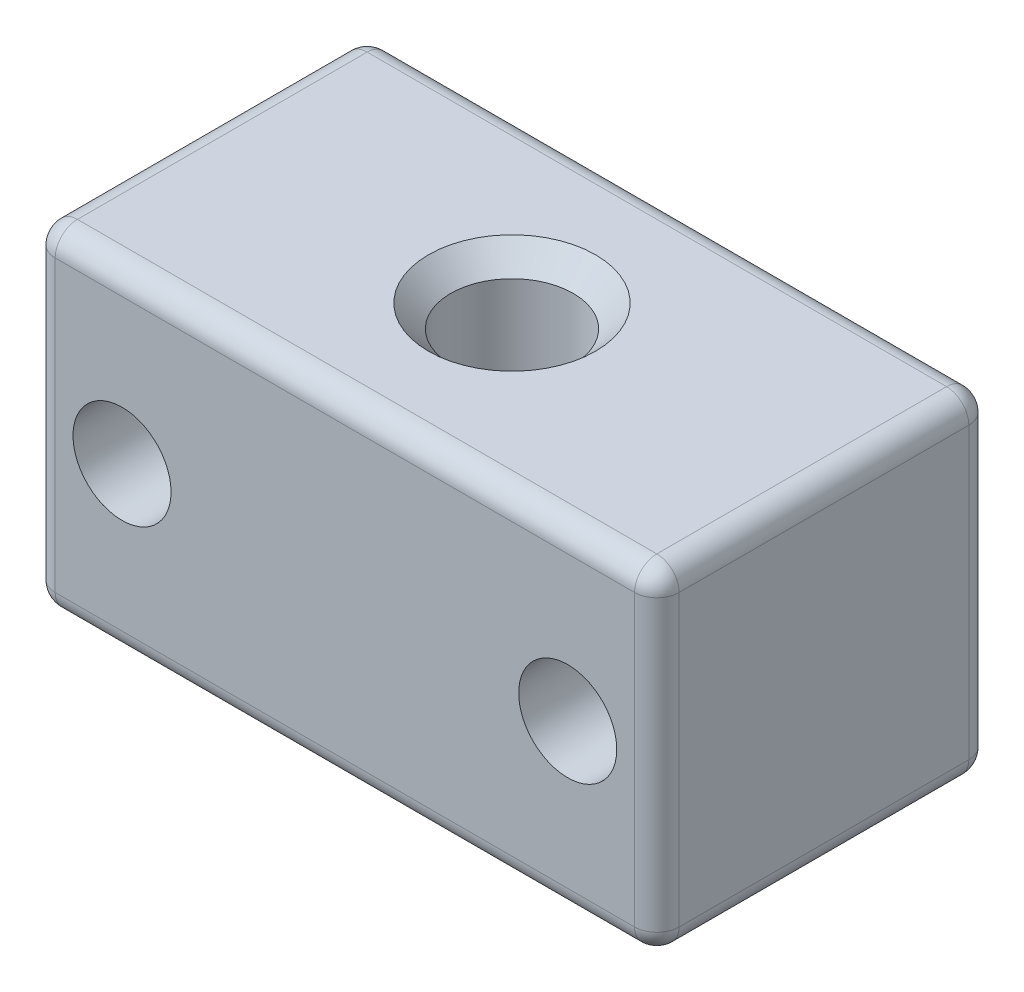
from build123d import *

# Parameters (mm, degrees)
SKETCH_1_W          = 28
SKETCH_1_H          = 15
SKETCH_1_R          = 2.75
EXTRUDE_1_DEPTH     = 7.5
SKETCH_2_R          = 2.2
CUT_EXTRUDE_1_DEPTH = 15
FILLET_1_R          = 1
CHAMFER_1_SIZE      = 1


with BuildPart() as part:
    # 草图1 → 凸台-拉伸1 (new, symmetric)
    with BuildSketch(Plane(origin=(0, 0, 0), x_dir=(1, 0, 0), z_dir=(0, 1, 0))):
        Rectangle(SKETCH_1_W, SKETCH_1_H)
        Circle(SKETCH_1_R, mode=Mode.SUBTRACT)
    extrude(amount=EXTRUDE_1_DEPTH, both=True)

    # 草图2 → 切除-拉伸1 (cut)
    with BuildSketch(Plane.XY.offset(7.5)):
        with Locations((-10, 0)):
            Circle(SKETCH_2_R)
        with Locations((10, 0)):
            Circle(SKETCH_2_R)
    extrude(amount=-CUT_EXTRUDE_1_DEPTH, mode=Mode.SUBTRACT)

    # 圆角1
    fillet_1_edges = [part.edges().sort_by_distance(p)[0] for p in [
        (14, 0, 7.5),
        (14, 7.5, 0),
        (14, 0, -7.5),
        (14, -7.5, 0),
        (-14, 0, -7.5),
        (-14, 7.5, 0),
        (-14, 0, 7.5),
        (-14, -7.5, 0),
        (0, -7.5, -7.5),
        (0, -7.5, 7.5),
        (0, 7.5, -7.5),
        (0, 7.5, 7.5),
    ]]
    fillet(fillet_1_edges, radius=FILLET_1_R)

    # 倒角1
    chamfer_1_edges = [part.edges().sort_by_distance(p)[0] for p in [
        (-2.75, -7.5, 0),
        (-2.75, 7.5, 0),
    ]]
    chamfer(chamfer_1_edges, length=CHAMFER_1_SIZE)


solid = part.part
